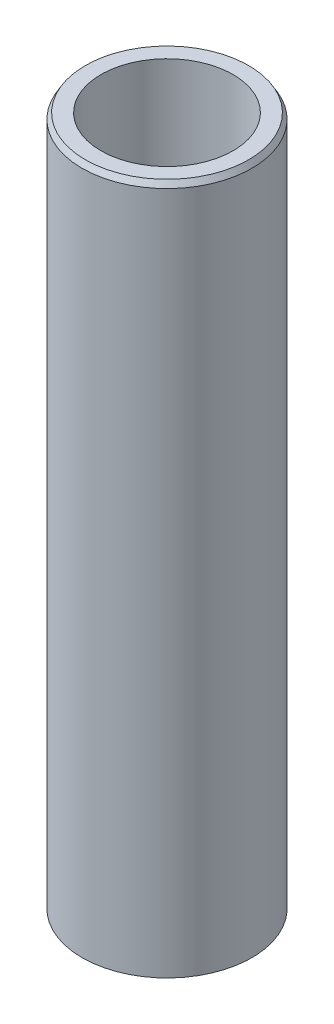
from build123d import *
from OCP.BRepFilletAPI import BRepFilletAPI_MakeChamfer

# Parameters (mm, degrees)
SKETCH1_R           = 52.5
BOSS_EXTRUDE1_DEPTH = 428.114433
SKETCH2_R           = 40.838278487
CUT_EXTRUDE1_DEPTH  = 435.504853532
CHAMFER1_SIZE       = 3.535827596
CHAMFER1_SIZE2      = 2.041411015


with BuildPart() as part:
    # Sketch1 → Boss-Extrude1 (new body)
    with BuildSketch(Plane(origin=(0, 0, 0), x_dir=(1, 0, 0), z_dir=(0, 1, 0))):
        Circle(SKETCH1_R)
    extrude(amount=BOSS_EXTRUDE1_DEPTH)

    # Sketch2 → Cut-Extrude1 (cut, through all)
    with BuildSketch(Plane(origin=(0, 0, 0), x_dir=(1, 0, 0), z_dir=(0, 1, 0))):
        Circle(SKETCH2_R)
    extrude(amount=CUT_EXTRUDE1_DEPTH, mode=Mode.SUBTRACT)

    # Chamfer1: one chamfer whose edges measure the first distance from different faces: ONE call of the kernel's chamfer builder (chamfer() names one face for all edges)
    chamfer1_edges_1 = [part.edges().sort_by_distance(p)[0] for p in [
        (-52.5, 428.114433, 0),
    ]]
    chamfer1_side_1 = [part.faces().sort_by_distance(p)[0] for p in [
        (-52.5, 214.0572165, 0),
    ]]
    chamfer1_edges_2 = [part.edges().sort_by_distance(p)[0] for p in [
        (-52.5, 0, 0),
    ]]
    chamfer1_side_2 = [part.faces().sort_by_distance(p)[0] for p in [
        (-51.01507576, 0, 0),
    ]]
    chamfer1 = BRepFilletAPI_MakeChamfer(part.part.solid().wrapped)
    for e in chamfer1_edges_1:
        chamfer1.Add(CHAMFER1_SIZE, CHAMFER1_SIZE2, e.wrapped, chamfer1_side_1[0].wrapped)  # the first distance lies on this face
    for e in chamfer1_edges_2:
        chamfer1.Add(CHAMFER1_SIZE, CHAMFER1_SIZE2, e.wrapped, chamfer1_side_2[0].wrapped)  # the first distance lies on this face
    add(Compound.cast(chamfer1.Shape()), mode=Mode.REPLACE)


solid = part.part
